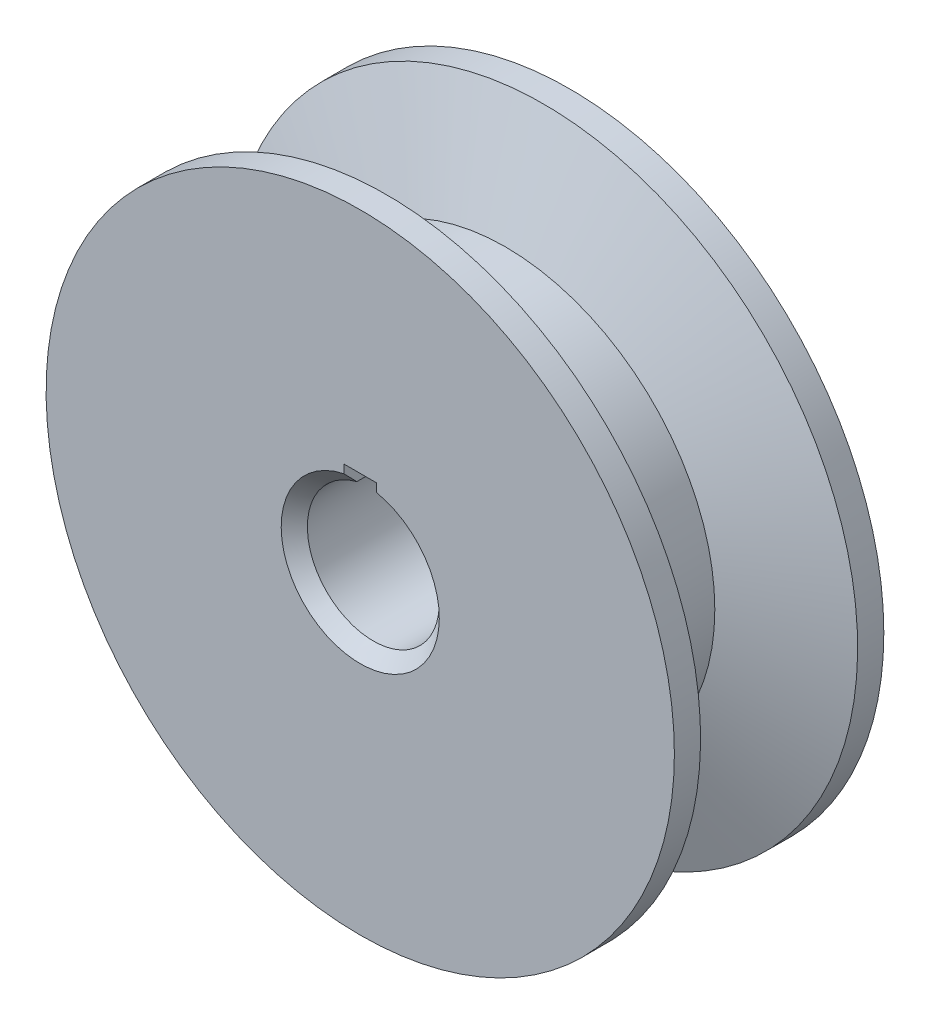
from build123d import *

# Parameters (mm, degrees)
SKETCH1_R          = 19.05
SKETCH1_R_2        = 4
EXTRUDE1_DEPTH     = 6.35
CHAMFER1_SIZE      = 0.79375
SKETCH3_W          = 2
SKETCH3_H          = 2.4
CUT_EXTRUDE1_DEPTH = 30.784140075


with BuildPart() as part:
    # Sketch1 → Extrude1 (new, symmetric)
    with BuildSketch(Plane.XY):
        Circle(SKETCH1_R)
        Circle(SKETCH1_R_2, mode=Mode.SUBTRACT)
    extrude(amount=EXTRUDE1_DEPTH, both=True)

    # Chamfer1
    chamfer1_edges = [part.edges().sort_by_distance(p)[0] for p in [
        (-4, 0, -6.35),
        (-4, 0, 6.35),
    ]]
    chamfer(chamfer1_edges, length=CHAMFER1_SIZE)

    # Sketch2 → Cut-Revolve1 (revolve, cut)
    with BuildSketch(Plane(origin=(0, 0, 0), x_dir=(0, 0, -1), z_dir=(1, 0, 0))):
        Polygon((-4.7625, 19.05), (4.7625, 19.05), (2.451289012, 12.7), (-2.451289012, 12.7), align=None)
    revolve(axis=Axis((0, 0, 6.35), (0, 0, -1)), mode=Mode.SUBTRACT)

    # Sketch3 → Cut-Extrude1 (cut, through all)
    with BuildSketch(Plane.XY.offset(6.35)):
        with Locations((0, 4)):
            Rectangle(SKETCH3_W, SKETCH3_H)
    extrude(amount=-CUT_EXTRUDE1_DEPTH, mode=Mode.SUBTRACT)


solid = part.part
